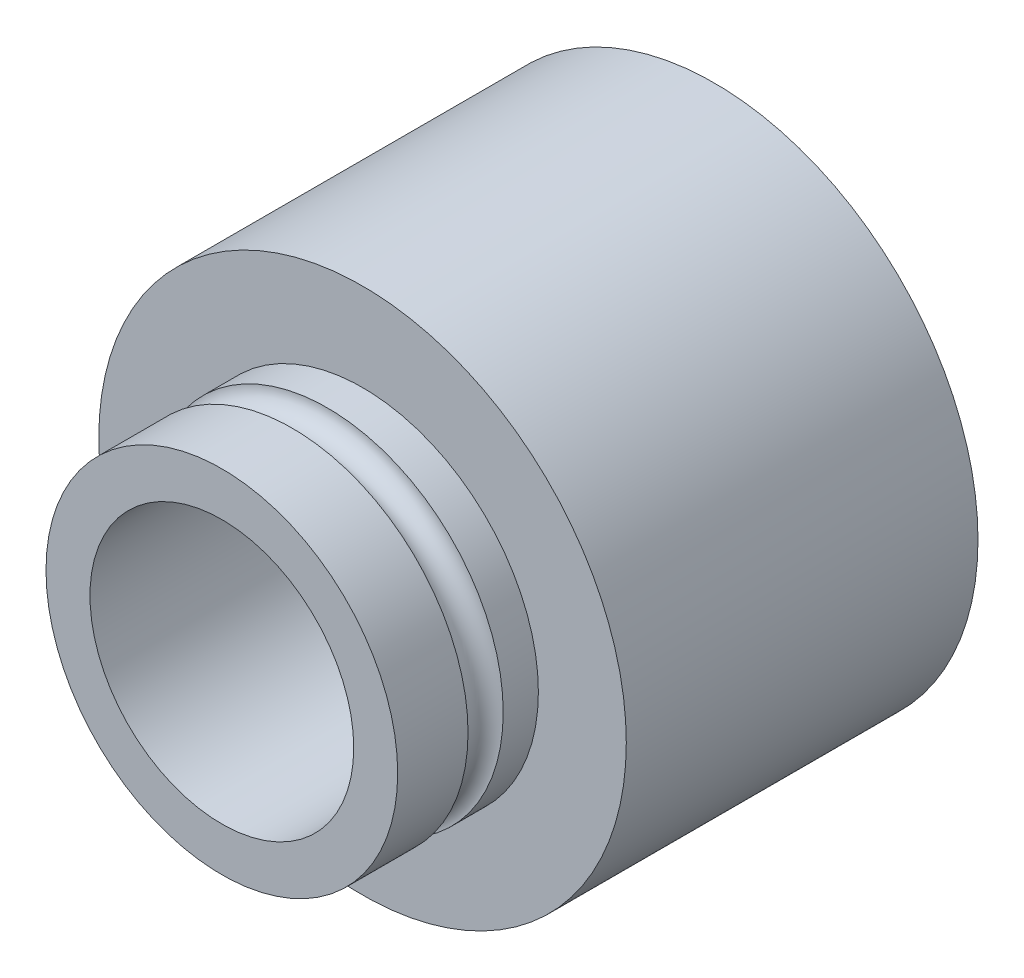
from build123d import *

# Parameters (mm, degrees)
SKETCH1_R                  = 15
BOSS_EXTRUDE1_DEPTH        = 10
SKETCH2_R                  = 10
CUT_EXTRUDE1_DEPTH         = 20
SKETCH3_R                  = 15
BOSS_EXTRUDE2_DEPTH        = 10
SKETCH5_R                  = 10
CUT_EXTRUDE3_DEPTH         = 8
SKETCH8_W                  = 0.75
SKETCH8_H                  = 0.75
CUT_EXTRUDE5_DEPTH         = 2
FILL_START                 = -1.125
FILL_PATTERN2_OUTLINE_W    = 0.75
FILL_PATTERN2_OUTLINE_H    = 2
FILL_PATTERN2_DEPTH        = 0.75
FILL_START_2               = 0.375
FILL_PATTERN2_2_OUTLINE_W  = 0.75
FILL_PATTERN2_2_OUTLINE_H  = 2
FILL_PATTERN2_2_DEPTH      = 0.75
FILL_START_3               = -3.375
FILL_PATTERN2_3_OUTLINE_W  = 0.75
FILL_PATTERN2_3_OUTLINE_H  = 2
FILL_PATTERN2_3_DEPTH      = 0.75
FILL_START_4               = -1.875
FILL_PATTERN2_4_OUTLINE_W  = 0.75
FILL_PATTERN2_4_OUTLINE_H  = 2
FILL_PATTERN2_4_DEPTH      = 0.75
FILL_START_5               = 1.125
FILL_PATTERN2_5_OUTLINE_W  = 0.75
FILL_PATTERN2_5_OUTLINE_H  = 2
FILL_PATTERN2_5_DEPTH      = 0.75
FILL_START_6               = 2.625
FILL_PATTERN2_6_OUTLINE_W  = 0.75
FILL_PATTERN2_6_OUTLINE_H  = 2
FILL_PATTERN2_6_DEPTH      = 0.75
FILL_START_7               = -4.125
FILL_PATTERN2_7_OUTLINE_W  = 0.75
FILL_PATTERN2_7_OUTLINE_H  = 2
FILL_PATTERN2_7_DEPTH      = 0.75
FILL_START_8               = -2.625
FILL_PATTERN2_8_OUTLINE_W  = 0.75
FILL_PATTERN2_8_OUTLINE_H  = 2
FILL_PATTERN2_8_DEPTH      = 0.75
FILL_START_9               = -0.375
FILL_PATTERN2_9_OUTLINE_W  = 0.75
FILL_PATTERN2_9_OUTLINE_H  = 2
FILL_PATTERN2_9_DEPTH      = 0.75
FILL_START_10              = 1.875
FILL_PATTERN2_10_OUTLINE_W = 0.75
FILL_PATTERN2_10_OUTLINE_H = 2
FILL_PATTERN2_10_DEPTH     = 0.75
FILL_START_11              = 3.375
FILL_PATTERN2_11_OUTLINE_W = 0.75
FILL_PATTERN2_11_OUTLINE_H = 2
FILL_PATTERN2_11_DEPTH     = 0.75
SKETCH15_W                 = 16
SKETCH15_H                 = 2.5
SKETCH16_R                 = 1


# Read off the part's stored shape, not the designer's step: Fill Pattern2
with BuildPart() as part:
    # Sketch1 → Boss-Extrude1 (new body)
    with BuildSketch(Plane.XY):
        Circle(SKETCH1_R)
    extrude(amount=BOSS_EXTRUDE1_DEPTH)

    # Sketch2 → Cut-Extrude1 (cut)
    with BuildSketch(Plane.XY.offset(10)):
        Circle(SKETCH2_R)
    extrude(amount=-CUT_EXTRUDE1_DEPTH, mode=Mode.SUBTRACT)

    # Sketch3 → Boss-Extrude2 (add)
    with BuildSketch(Plane.XY.offset(10)):
        Circle(SKETCH3_R)
    extrude(amount=BOSS_EXTRUDE2_DEPTH)

    # Sketch5 → Cut-Extrude3 (cut)
    with BuildSketch(Plane.XY.offset(20)):
        Circle(SKETCH5_R)
    extrude(amount=-CUT_EXTRUDE3_DEPTH, mode=Mode.SUBTRACT)

    # Sketch8 → Cut-Extrude5 (cut)
    with BuildSketch(Plane(origin=(0, 0, 10), x_dir=(-1, 0, 0), z_dir=(0, 0, -1))):
        Rectangle(SKETCH8_W, SKETCH8_H)
    extrude(amount=-CUT_EXTRUDE5_DEPTH, mode=Mode.SUBTRACT)

    # Fill Pattern2 outline → Fill Pattern2 (cut)
    with BuildSketch(Plane.YZ.offset(FILL_START)):
        with Locations((-1.299038106, 11)):
            Rectangle(FILL_PATTERN2_OUTLINE_W, FILL_PATTERN2_OUTLINE_H)
        with Locations((1.299038106, 11)):
            Rectangle(FILL_PATTERN2_OUTLINE_W, FILL_PATTERN2_OUTLINE_H)
        with Locations((-3.897114317, 11)):
            Rectangle(FILL_PATTERN2_OUTLINE_W, FILL_PATTERN2_OUTLINE_H)
        with Locations((3.897114317, 11)):
            Rectangle(FILL_PATTERN2_OUTLINE_W, FILL_PATTERN2_OUTLINE_H)
    extrude(amount=FILL_PATTERN2_DEPTH, mode=Mode.SUBTRACT)

    # Fill Pattern2 2 outline → Fill Pattern2 2 (cut)
    with BuildSketch(Plane.YZ.offset(FILL_START_2)):
        with Locations((-1.299038106, 11)):
            Rectangle(FILL_PATTERN2_2_OUTLINE_W, FILL_PATTERN2_2_OUTLINE_H)
        with Locations((1.299038106, 11)):
            Rectangle(FILL_PATTERN2_2_OUTLINE_W, FILL_PATTERN2_2_OUTLINE_H)
        with Locations((-3.897114317, 11)):
            Rectangle(FILL_PATTERN2_2_OUTLINE_W, FILL_PATTERN2_2_OUTLINE_H)
        with Locations((3.897114317, 11)):
            Rectangle(FILL_PATTERN2_2_OUTLINE_W, FILL_PATTERN2_2_OUTLINE_H)
    extrude(amount=FILL_PATTERN2_2_DEPTH, mode=Mode.SUBTRACT)

    # Fill Pattern2 3 outline → Fill Pattern2 3 (cut)
    with BuildSketch(Plane.YZ.offset(FILL_START_3)):
        with Locations((0, 11)):
            Rectangle(FILL_PATTERN2_3_OUTLINE_W, FILL_PATTERN2_3_OUTLINE_H)
        with Locations((-2.598076211, 11)):
            Rectangle(FILL_PATTERN2_3_OUTLINE_W, FILL_PATTERN2_3_OUTLINE_H)
        with Locations((2.598076211, 11)):
            Rectangle(FILL_PATTERN2_3_OUTLINE_W, FILL_PATTERN2_3_OUTLINE_H)
    extrude(amount=FILL_PATTERN2_3_DEPTH, mode=Mode.SUBTRACT)

    # Fill Pattern2 4 outline → Fill Pattern2 4 (cut)
    with BuildSketch(Plane.YZ.offset(FILL_START_4)):
        with Locations((0, 11)):
            Rectangle(FILL_PATTERN2_4_OUTLINE_W, FILL_PATTERN2_4_OUTLINE_H)
        with Locations((-2.598076211, 11)):
            Rectangle(FILL_PATTERN2_4_OUTLINE_W, FILL_PATTERN2_4_OUTLINE_H)
        with Locations((2.598076211, 11)):
            Rectangle(FILL_PATTERN2_4_OUTLINE_W, FILL_PATTERN2_4_OUTLINE_H)
    extrude(amount=FILL_PATTERN2_4_DEPTH, mode=Mode.SUBTRACT)

    # Fill Pattern2 5 outline → Fill Pattern2 5 (cut)
    with BuildSketch(Plane.YZ.offset(FILL_START_5)):
        with Locations((0, 11)):
            Rectangle(FILL_PATTERN2_5_OUTLINE_W, FILL_PATTERN2_5_OUTLINE_H)
        with Locations((-2.598076211, 11)):
            Rectangle(FILL_PATTERN2_5_OUTLINE_W, FILL_PATTERN2_5_OUTLINE_H)
        with Locations((2.598076211, 11)):
            Rectangle(FILL_PATTERN2_5_OUTLINE_W, FILL_PATTERN2_5_OUTLINE_H)
    extrude(amount=FILL_PATTERN2_5_DEPTH, mode=Mode.SUBTRACT)

    # Fill Pattern2 6 outline → Fill Pattern2 6 (cut)
    with BuildSketch(Plane.YZ.offset(FILL_START_6)):
        with Locations((0, 11)):
            Rectangle(FILL_PATTERN2_6_OUTLINE_W, FILL_PATTERN2_6_OUTLINE_H)
        with Locations((-2.598076211, 11)):
            Rectangle(FILL_PATTERN2_6_OUTLINE_W, FILL_PATTERN2_6_OUTLINE_H)
        with Locations((2.598076211, 11)):
            Rectangle(FILL_PATTERN2_6_OUTLINE_W, FILL_PATTERN2_6_OUTLINE_H)
    extrude(amount=FILL_PATTERN2_6_DEPTH, mode=Mode.SUBTRACT)

    # Fill Pattern2 7 outline → Fill Pattern2 7 (cut)
    with BuildSketch(Plane.YZ.offset(FILL_START_7)):
        with Locations((-1.299038106, 11)):
            Rectangle(FILL_PATTERN2_7_OUTLINE_W, FILL_PATTERN2_7_OUTLINE_H)
        with Locations((1.299038106, 11)):
            Rectangle(FILL_PATTERN2_7_OUTLINE_W, FILL_PATTERN2_7_OUTLINE_H)
    extrude(amount=FILL_PATTERN2_7_DEPTH, mode=Mode.SUBTRACT)

    # Fill Pattern2 8 outline → Fill Pattern2 8 (cut)
    with BuildSketch(Plane.YZ.offset(FILL_START_8)):
        with Locations((-1.299038106, 11)):
            Rectangle(FILL_PATTERN2_8_OUTLINE_W, FILL_PATTERN2_8_OUTLINE_H)
        with Locations((1.299038106, 11)):
            Rectangle(FILL_PATTERN2_8_OUTLINE_W, FILL_PATTERN2_8_OUTLINE_H)
    extrude(amount=FILL_PATTERN2_8_DEPTH, mode=Mode.SUBTRACT)

    # Fill Pattern2 9 outline → Fill Pattern2 9 (cut)
    with BuildSketch(Plane.YZ.offset(FILL_START_9)):
        with Locations((-2.598076211, 11)):
            Rectangle(FILL_PATTERN2_9_OUTLINE_W, FILL_PATTERN2_9_OUTLINE_H)
        with Locations((2.598076211, 11)):
            Rectangle(FILL_PATTERN2_9_OUTLINE_W, FILL_PATTERN2_9_OUTLINE_H)
    extrude(amount=FILL_PATTERN2_9_DEPTH, mode=Mode.SUBTRACT)

    # Fill Pattern2 10 outline → Fill Pattern2 10 (cut)
    with BuildSketch(Plane.YZ.offset(FILL_START_10)):
        with Locations((-1.299038106, 11)):
            Rectangle(FILL_PATTERN2_10_OUTLINE_W, FILL_PATTERN2_10_OUTLINE_H)
        with Locations((1.299038106, 11)):
            Rectangle(FILL_PATTERN2_10_OUTLINE_W, FILL_PATTERN2_10_OUTLINE_H)
    extrude(amount=FILL_PATTERN2_10_DEPTH, mode=Mode.SUBTRACT)

    # Fill Pattern2 11 outline → Fill Pattern2 11 (cut)
    with BuildSketch(Plane.YZ.offset(FILL_START_11)):
        with Locations((-1.299038106, 11)):
            Rectangle(FILL_PATTERN2_11_OUTLINE_W, FILL_PATTERN2_11_OUTLINE_H)
        with Locations((1.299038106, 11)):
            Rectangle(FILL_PATTERN2_11_OUTLINE_W, FILL_PATTERN2_11_OUTLINE_H)
    extrude(amount=FILL_PATTERN2_11_DEPTH, mode=Mode.SUBTRACT)

    # Sketch15 → Revolve2 (revolve)
    with BuildSketch(Plane(origin=(0, 0, 0), x_dir=(0, 0, -1), z_dir=(1, 0, 0)), mode=Mode.PRIVATE) as revolve2_sk:
        with Locations((-20, -8.75)):
            Rectangle(SKETCH15_W, SKETCH15_H)
    revolve(revolve2_sk.sketch.rotate(Axis((0, 0, 20), (0, 0, -1)), 270), axis=Axis((0, 0, 20), (0, 0, -1)))

    # Sketch16 → Cut-Revolve2 (revolve, cut)
    with BuildSketch(Plane(origin=(0, 0, 0), x_dir=(0, 0, -1), z_dir=(1, 0, 0)), mode=Mode.PRIVATE) as cut_revolve2_sk:
        with Locations((-23, 10)):
            Circle(SKETCH16_R)
    revolve(cut_revolve2_sk.sketch.rotate(Axis((0, 0, 20), (0, 0, -1)), 90), axis=Axis((0, 0, 20), (0, 0, -1)), mode=Mode.SUBTRACT)


solid = part.part
